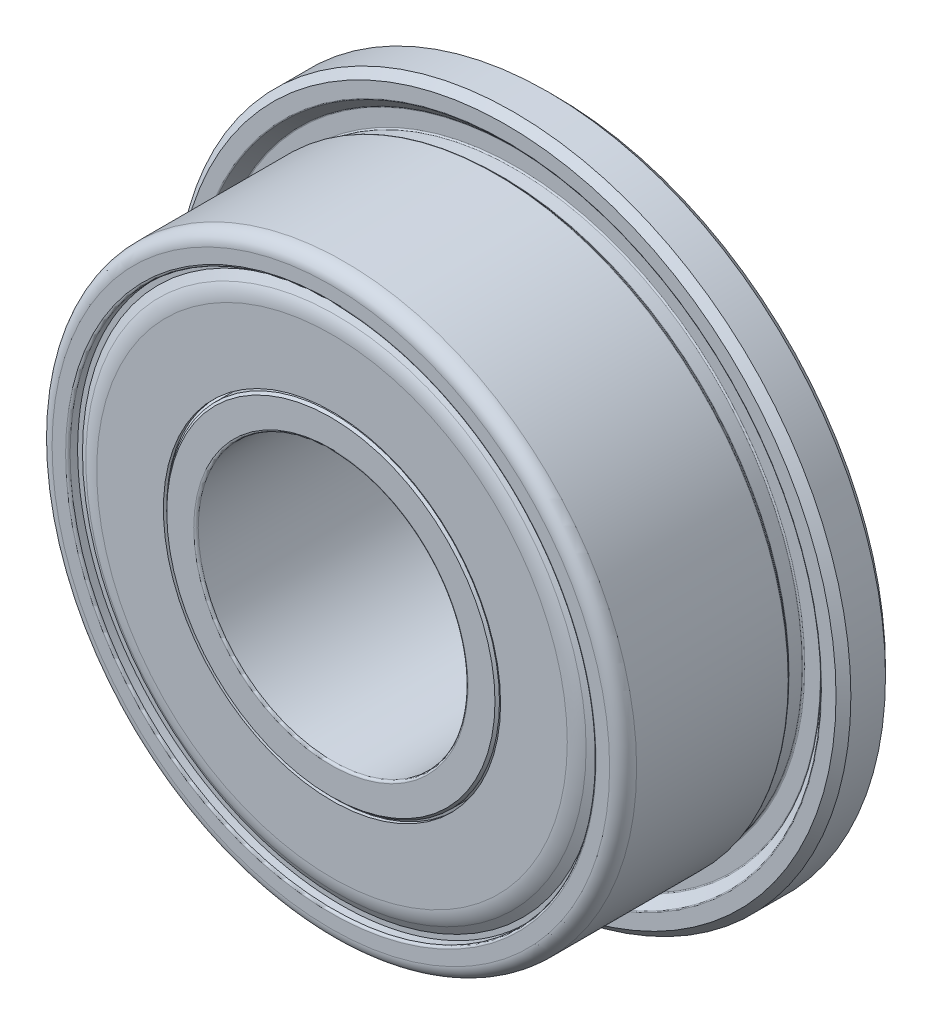
from build123d import *

# Parameters (mm, degrees)
CIRPATTERN1_COUNT  = 8
SKETCH9_R          = 3.75
CUT_EXTRUDE1_DEPTH = 11.452302378
SKETCH7_W          = 1.1
SKETCH7_H          = 1.65
FILLET2_R          = 0.3
FILLET3_R          = 0.05
FILLET5_R          = 0.03
CHAMFER1_SIZE      = 0.165
FILLET7_R          = 0.05


with BuildPart() as part:
    # Sketch3 → Revolve1 (revolve)
    with BuildSketch(Plane(origin=(0, 0, 0), x_dir=(0, 0, -1), z_dir=(1, 0, 0)), mode=Mode.PRIVATE) as revolve1_sk:
        with BuildLine():
            Line((-2.5, 6.5), (-2.5, 5.85))
            Line((-2.5, 5.85), (-0.789887484, 5.85))
            Line((-0.789887484, 5.85), (-0.789887484, 5.42))
            Line((-0.789887484, 5.42), (-0.589887484, 5.42))
            ThreePointArc((-0.589887484, 5.42), (0, 5.605646545), (0.589887484, 5.42))
            Line((0.589887484, 5.42), (0.789887484, 5.42))
            Line((0.789887484, 5.42), (0.789887484, 5.85))
            Line((0.789887484, 5.85), (2.5, 5.85))
            Line((2.5, 5.85), (2.5, 6.5))
            Line((2.5, 6.5), (-2.5, 6.5))
        make_face()
        with BuildLine():
            Line((2.5, 3), (-2.5, 3))
            Line((-2.5, 3), (-2.5, 3.7))
            Line((-2.5, 3.7), (-0.589887484, 3.7))
            ThreePointArc((-0.589887484, 3.7), (0, 3.545646545), (0.589887484, 3.7))
            Line((0.589887484, 3.7), (2.5, 3.7))
            Line((2.5, 3.7), (2.5, 3))
        make_face()
    revolve(revolve1_sk.sketch.rotate(Axis((0, 0, 2.5), (0, 0, -1)), 90), axis=Axis((0, 0, 2.5), (0, 0, -1)))

    # Sketch7 → Revolve5 (revolve)
    with BuildSketch(Plane(origin=(0, 0, 0), x_dir=(0, 0, -1), z_dir=(1, 0, 0)), mode=Mode.PRIVATE) as revolve5_sk:
        with Locations((1.95, 6.675)):
            Rectangle(SKETCH7_W, SKETCH7_H)
    revolve(revolve5_sk.sketch.rotate(Axis((0, 0, -2.5), (0, 0, 1)), 270), axis=Axis((0, 0, -2.5), (0, 0, 1)))

    # Fillet2
    fillet2_edges = [part.edges().sort_by_distance(p)[0] for p in [
        (-6.5, 0, 2.5),
    ]]
    fillet(fillet2_edges, radius=FILLET2_R)

    # Fillet3
    fillet3_edges = [part.edges().sort_by_distance(p)[0] for p in [
        (-5.85, 0, 0.789887484),
        (-5.85, 0, 2.5),
        (-5.85, 0, -2.5),
        (-5.85, 0, -0.789887484),
    ]]
    fillet(fillet3_edges, radius=FILLET3_R)

    # Fillet6
    # the kernel refuses this chamfer: 0.05 mm, written as the material it takes off along each edge
    with BuildSketch(Plane(origin=(0, 0, 2.5), x_dir=(1, 0, 0), z_dir=(0, 1, 0))) as fillet6_piece_1:
        with BuildLine():
            Line((3.648585786, -0.001414214), (3.701414214, 0.051414214))
            Line((3.701414214, 0.051414214), (3.702414214, 0.051414214))
            ThreePointArc((3.702414214, 0.051414214), (3.701, 0.025707107), (3.701, 0))
            Line((3.701, 0), (3.7, -0.001))
            ThreePointArc((3.7, -0.001), (3.674292893, -0.001), (3.648585786, -0.002414214))
            Line((3.648585786, -0.002414214), (3.648585786, -0.001414214))
        make_face()
    revolve(axis=Axis((0, 0, 2.5), (0, 0, -1)), mode=Mode.SUBTRACT)
    with BuildSketch(Plane(origin=(0, 0, 0.589887484), x_dir=(1, 0, 0), z_dir=(0, 1, 0))) as fillet6_piece_2:
        with BuildLine():
            Line((3.700496093, -0.014878835), (3.693351197, 0.013025622))
            Line((3.693351197, 0.013025622), (3.694228143, 0.013506211))
            ThreePointArc((3.694228143, 0.013506211), (3.697314684, 0.006866763), (3.700871837, 0.000489796))
            Line((3.700871837, 0.000489796), (3.701, 0))
            ThreePointArc((3.701, 0), (3.701, -0.007439417), (3.701496093, -0.014878835))
            Line((3.701496093, -0.014878835), (3.700496093, -0.014878835))
        make_face()
    revolve(axis=Axis((0, 0, 0.589887484), (0, 0, -1)), mode=Mode.SUBTRACT)
    with BuildSketch(Plane(origin=(0, 0, -0.589887484), x_dir=(1, 0, 0), z_dir=(0, 1, 0))) as fillet6_piece_3:
        with BuildLine():
            Line((3.700496093, 0.014878835), (3.693351197, -0.013025622))
            Line((3.693351197, -0.013025622), (3.694228143, -0.013506211))
            ThreePointArc((3.694228143, -0.013506211), (3.697314684, -0.006866763), (3.700871837, -0.000489796))
            Line((3.700871837, -0.000489796), (3.701, 0))
            ThreePointArc((3.701, 0), (3.701, 0.007439417), (3.701496093, 0.014878835))
            Line((3.701496093, 0.014878835), (3.700496093, 0.014878835))
        make_face()
    revolve(axis=Axis((0, 0, -0.589887484), (0, 0, -1)), mode=Mode.SUBTRACT)
    with BuildSketch(Plane(origin=(0, 0, -2.5), x_dir=(1, 0, 0), z_dir=(0, 1, 0))) as fillet6_piece_4:
        with BuildLine():
            Line((3.701414214, -0.051414214), (3.648585786, 0.001414214))
            Line((3.648585786, 0.001414214), (3.648585786, 0.002414214))
            ThreePointArc((3.648585786, 0.002414214), (3.674292893, 0.001), (3.7, 0.001))
            Line((3.7, 0.001), (3.701, 0))
            ThreePointArc((3.701, 0), (3.701, -0.025707107), (3.702414214, -0.051414214))
            Line((3.702414214, -0.051414214), (3.701414214, -0.051414214))
        make_face()
    revolve(axis=Axis((0, 0, -2.5), (0, 0, -1)), mode=Mode.SUBTRACT)

    # Sketch8 → Cut-Revolve1 (revolve, cut)
    with BuildSketch(Plane(origin=(0, 0, 0), x_dir=(0, 0, -1), z_dir=(1, 0, 0)), mode=Mode.PRIVATE) as cut_revolve1_sk:
        Polygon((1.4, 7), (1.62, 6.78), (1.62, 6.39), (1.29, 6.39), (1.18, 6.5), (1.4, 6.5), align=None)
    revolve(cut_revolve1_sk.sketch.rotate(Axis((0, 0, 2.5), (0, 0, -1)), 270), axis=Axis((0, 0, 2.5), (0, 0, -1)), mode=Mode.SUBTRACT)

    # Fillet5
    fillet5_edges = [part.edges().sort_by_distance(p)[0] for p in [
        (7, 0, -1.4),
        (0, 6.5, -1.18),
        (6.39, 0, -1.29),
        (6.39, 0, -1.62),
        (6.78, 0, -1.62),
    ]]
    fillet(fillet5_edges, radius=FILLET5_R)

    # Chamfer1
    chamfer1_edges = [part.edges().sort_by_distance(p)[0] for p in [
        (-7.5, 0, -2.5),
        (-7.5, 0, -1.4),
    ]]
    chamfer(chamfer1_edges, length=CHAMFER1_SIZE)

    # Fillet7
    fillet7_edges = [part.edges().sort_by_distance(p)[0] for p in [
        (-3, 0, -2.5),
        (-3, 0, 2.5),
    ]]
    fillet(fillet7_edges, radius=FILLET7_R)


with BuildPart() as body_2:
    # Sketch5 → Revolve3 (revolve)
    with BuildSketch(Plane(origin=(0, 0, 0), x_dir=(0, 0, -1), z_dir=(1, 0, 0))):
        with BuildLine():
            Line((-1, 4.575646545), (1, 4.575646545))
            ThreePointArc((1, 4.575646545), (0, 5.575646545), (-1, 4.575646545))
        make_face()
    revolve(axis=Axis((0, 4.575646545, 1), (0, 0, -1)))


with BuildPart() as cirpattern1_1:
    # CirPattern1: pattern copy
    add(body_2.part.rotate(Axis((0, 0, 0), (0, 0, 1)), 1 * 360 / CIRPATTERN1_COUNT))


with BuildPart() as cirpattern1_2:
    # CirPattern1: pattern copy
    add(body_2.part.rotate(Axis((0, 0, 0), (0, 0, 1)), 2 * 360 / CIRPATTERN1_COUNT))


with BuildPart() as cirpattern1_3:
    # CirPattern1: pattern copy
    add(body_2.part.rotate(Axis((0, 0, 0), (0, 0, 1)), 3 * 360 / CIRPATTERN1_COUNT))


with BuildPart() as cirpattern1_4:
    # CirPattern1: pattern copy
    add(body_2.part.rotate(Axis((0, 0, 0), (0, 0, 1)), 4 * 360 / CIRPATTERN1_COUNT))


with BuildPart() as cirpattern1_5:
    # CirPattern1: pattern copy
    add(body_2.part.rotate(Axis((0, 0, 0), (0, 0, 1)), 5 * 360 / CIRPATTERN1_COUNT))


with BuildPart() as cirpattern1_6:
    # CirPattern1: pattern copy
    add(body_2.part.rotate(Axis((0, 0, 0), (0, 0, 1)), 6 * 360 / CIRPATTERN1_COUNT))


with BuildPart() as cirpattern1_7:
    # CirPattern1: pattern copy
    add(body_2.part.rotate(Axis((0, 0, 0), (0, 0, 1)), 7 * 360 / CIRPATTERN1_COUNT))


with BuildPart() as body_10:
    # Sketch6 → Revolve4 (revolve)
    with BuildSketch(Plane(origin=(0, 0, 0), x_dir=(0, 0, -1), z_dir=(1, 0, 0)), mode=Mode.PRIVATE) as revolve4_sk:
        with BuildLine():
            Line((-2.475, 3.7), (-2.475, 5.233153533))
            ThreePointArc((-2.475, 5.233153533), (-2.452511045, 5.403974103), (-2.386576766, 5.563153533))
            Line((-2.386576766, 5.563153533), (-2.284474411, 5.74))
            Line((-2.284474411, 5.74), (-2.284474411, 5.85))
            Line((-2.284474411, 5.85), (-2.197871871, 5.85))
            Line((-2.197871871, 5.85), (-2.197871871, 5.74))
            Line((-2.197871871, 5.74), (-2.4, 5.389903811))
            Line((-2.4, 5.389903811), (-2.4, 3.7))
            Line((-2.4, 3.7), (-2.475, 3.7))
        make_face()
    revolve(revolve4_sk.sketch.rotate(Axis((0, 0, 2.5), (0, 0, -1)), 90), axis=Axis((0, 0, 2.5), (0, 0, -1)))


with BuildPart() as body_11:
    # Mirror1: mirrored copy
    add(body_10.part.mirror(Plane.XY))


with BuildPart() as cut_extrude1_tool:
    # Sketch9 → Cut-Extrude1 (new, through all)
    with BuildSketch(Plane.XY.offset(2.475)):
        Circle(SKETCH9_R)
    extrude(amount=-CUT_EXTRUDE1_DEPTH)


with BuildPart() as body_10_1:
    add(body_10.part)

    # Cut-Extrude1: cut by cut_extrude1_tool
    add(cut_extrude1_tool.part, mode=Mode.SUBTRACT)


with BuildPart() as body_11_1:
    add(body_11.part)

    # Cut-Extrude1: cut by cut_extrude1_tool
    add(cut_extrude1_tool.part, mode=Mode.SUBTRACT)


solid = Compound([part.part, body_2.part, cirpattern1_1.part, cirpattern1_2.part, cirpattern1_3.part, cirpattern1_4.part, cirpattern1_5.part, cirpattern1_6.part, cirpattern1_7.part, body_10_1.part, body_11_1.part])
